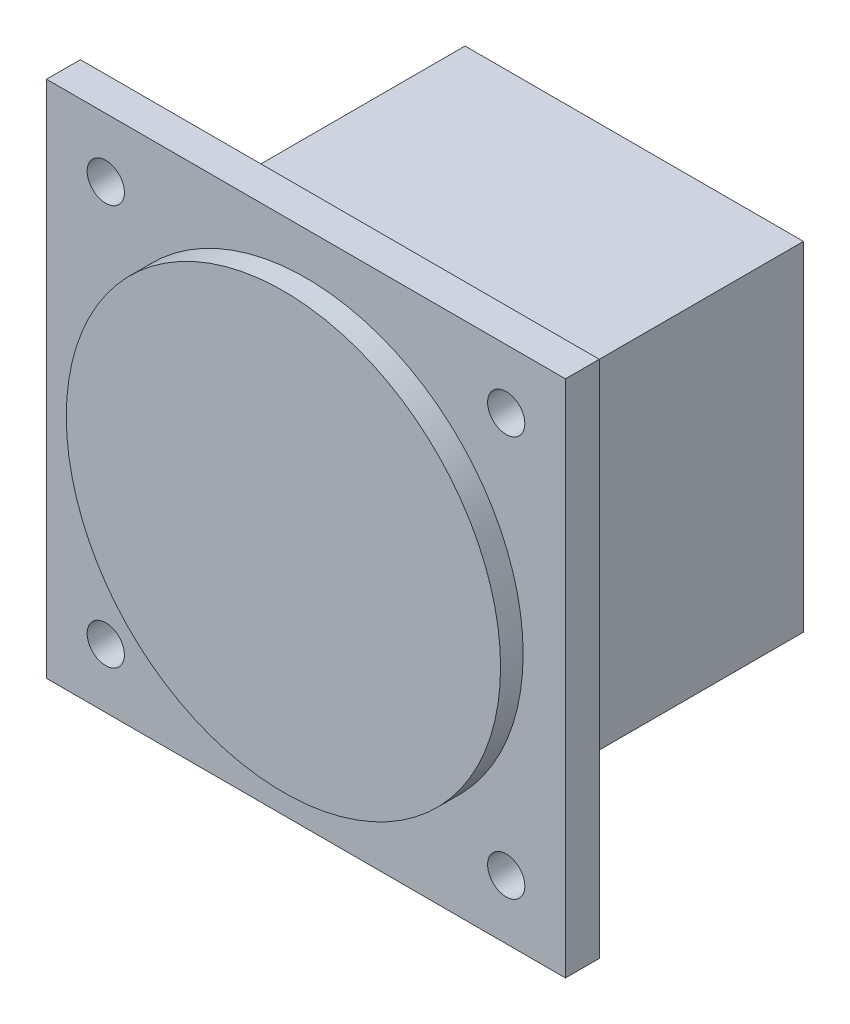
from build123d import *

# Parameters (mm, degrees)
SKETCH1_W           = 46
SKETCH1_H           = 46
SKETCH1_R           = 1.65
BOSS_EXTRUDE1_DEPTH = 3
SKETCH2_R           = 19.25
BOSS_EXTRUDE2_DEPTH = 2
SKETCH3_W           = 30
SKETCH3_H           = 30
BOSS_EXTRUDE3_DEPTH = 26.1


with BuildPart() as part:
    # Sketch1 → Boss-Extrude1 (new body)
    with BuildSketch(Plane.XY):
        Rectangle(SKETCH1_W, SKETCH1_H)
        with Locations((-17.748380208, 17.748380208)):
            Circle(SKETCH1_R, mode=Mode.SUBTRACT)
        with Locations((17.748380208, 17.748380208)):
            Circle(SKETCH1_R, mode=Mode.SUBTRACT)
        with Locations((17.748380208, -17.748380208)):
            Circle(SKETCH1_R, mode=Mode.SUBTRACT)
        with Locations((-17.748380208, -17.748380208)):
            Circle(SKETCH1_R, mode=Mode.SUBTRACT)
    extrude(amount=BOSS_EXTRUDE1_DEPTH)

    # Sketch2 → Boss-Extrude2 (add)
    with BuildSketch(Plane.XY.offset(3)):
        Circle(SKETCH2_R)
    extrude(amount=BOSS_EXTRUDE2_DEPTH)

    # Sketch3 → Boss-Extrude3 (add)
    with BuildSketch(Plane(origin=(0, 0, 0), x_dir=(-1, 0, 0), z_dir=(0, 0, -1))):
        Rectangle(SKETCH3_W, SKETCH3_H)
    extrude(amount=BOSS_EXTRUDE3_DEPTH)


solid = part.part
